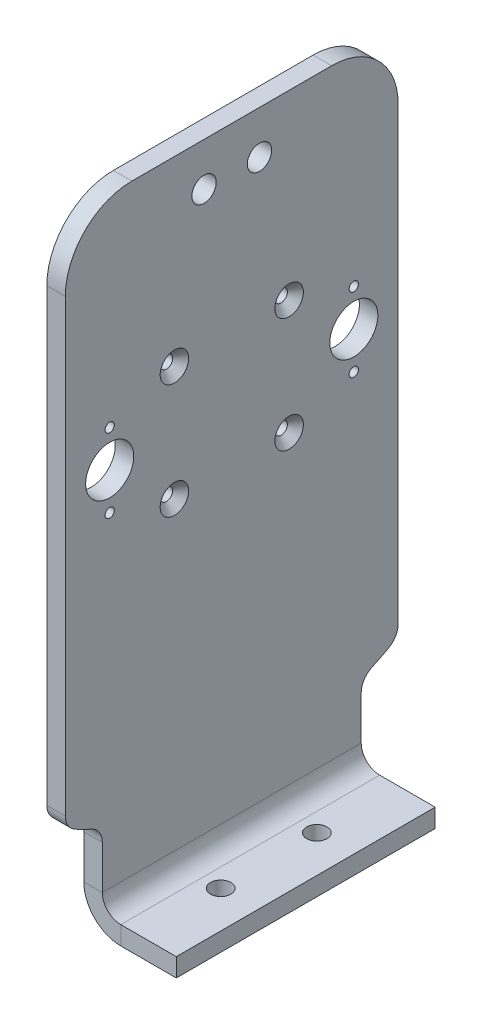
from build123d import *

# Parameters (mm, degrees)
ESBO_O1_W                                           = 20
ESBO_O1_H                                           = 70
FLANGE_BASE1_DEPTH                                  = 5
ARESTA_FLANGE1_STRIP_W                              = 30
ARESTA_FLANGE1_STRIP_H                              = 5
ARESTA_FLANGE1_STRIP_CUT_DEPTH                      = 70
ARESTA_FLANGE1_DEPTH                                = 70
ARESTA_FLANGE1_START                                = 5
ARESTA_FLANGE1_PROFILE_W                            = 90
ARESTA_FLANGE1_PROFILE_H                            = 162.6
ARESTA_FLANGE1_FLAT_DEPTH                           = 5
CORTE_EXTRUS_O1_DEPTH                               = 5
CORTE_EXTRUS_O2_DEPTH                               = 5
FILETE1_R                                           = 5
FILETE2_R                                           = 5
CORTE_EXTRUS_O3_REACH                               = 177.328
ESBO_O14_R                                          = 6.5
FILETE3_R                                           = 18
FILETE4_R                                           = 18
ESBO_O27_R                                          = 3.3
CORTE_EXTRUS_O4_DEPTH                               = 5
ESBO_O28_R                                          = 2.75
CORTE_EXTRUS_O5_DEPTH                               = 5
ESCAREADO_PARA_PARAFUSO_ALLEN_SEXTAVADO_D           = 3.4
ESCAREADO_PARA_PARAFUSO_ALLEN_SEXTAVADO_CSINK_D     = 7.72
ESCAREADO_PARA_PARAFUSO_ALLEN_SEXTAVADO_CSINK_ANGLE = 90
ESBO_O34_R                                          = 1.25
CORTE_EXTRUS_O6_DEPTH                               = 5


# Sheet-metal steps are written as plain solids
with BuildPart() as part:
    # Esboço1 → Flange-base1 (new body)
    with BuildSketch(Plane(origin=(0, 0, 0), x_dir=(1, 0, 0), z_dir=(0, 1, 0))):
        Rectangle(ESBO_O1_W, ESBO_O1_H)
    extrude(amount=-FLANGE_BASE1_DEPTH)

    # Aresta-Flange1 strip (across the edge) → Aresta-Flange1 strip cut (cut)
    with BuildSketch(Plane(origin=(-10, 0, -35), x_dir=(1, 0, 0), z_dir=(0, 0, 1))):
        with Locations((-10, -2.5)):
            Rectangle(ARESTA_FLANGE1_STRIP_W, ARESTA_FLANGE1_STRIP_H)
    extrude(amount=ARESTA_FLANGE1_STRIP_CUT_DEPTH, mode=Mode.SUBTRACT)

    # Aresta-Flange1 bend section (across the edge) → Aresta-Flange1 (add)
    with BuildSketch(Plane(origin=(-10, 0, -35), x_dir=(1, 0, 0), z_dir=(0, 0, 1))):
        with BuildLine():
            Line((-5, 5), (0, 5))
            ThreePointArc((0, 5), (1.464466094, 1.464466094), (5, 0))
            Line((5, 0), (5, -5))
            ThreePointArc((5, -5), (-2.071067812, -2.071067812), (-5, 5))
        make_face()
    extrude(amount=ARESTA_FLANGE1_DEPTH)

    # Aresta-Flange1 profile (on flange) → Aresta-Flange1 flat (add)
    with BuildSketch(Plane.ZY.offset(10).offset(ARESTA_FLANGE1_START)):
        with Locations((0, 86.3)):
            Rectangle(ARESTA_FLANGE1_PROFILE_W, ARESTA_FLANGE1_PROFILE_H)
    extrude(amount=-ARESTA_FLANGE1_FLAT_DEPTH)

    # Esboço11 → Corte-extrusão1 (cut)
    with BuildSketch(Plane(origin=(-10, 0, 0), x_dir=(0, 0, -1), z_dir=(1, 0, 0))):
        with BuildLine():
            Line((35, 5.5), (35, 16.756560302))
            ThreePointArc((35, 16.756560302), (35.785363848, 19.446698236), (37.894736842, 21.291741339))
            ThreePointArc((37.894736842, 21.291741339), (40.139210452, 22.371640143), (42.352941176, 23.513235294))
            ThreePointArc((42.352941176, 23.513235294), (44.287464629, 25.352521223), (45, 27.925))
            Line((45, 27.925), (45, 5))
            Line((45, 5), (35, 5))
            Line((35, 5), (35, 5.5))
        make_face()
    extrude(amount=-CORTE_EXTRUS_O1_DEPTH, mode=Mode.SUBTRACT)

    # Esboço12 → Corte-extrusão2 (cut)
    with BuildSketch(Plane(origin=(-10, 0, 0), x_dir=(0, 0, -1), z_dir=(1, 0, 0))):
        with BuildLine():
            Line((-45, 5), (-35, 5))
            Line((-35, 5), (-35, 20.009380241))
            ThreePointArc((-35, 20.009380241), (-40.077219356, 22.340780151), (-45, 24.982713659))
            Line((-45, 24.982713659), (-45, 5))
        make_face()
    extrude(amount=-CORTE_EXTRUS_O2_DEPTH, mode=Mode.SUBTRACT)

    # Filete1
    filete1_edges = [part.edges().sort_by_distance(p)[0] for p in [
        (-12.5, 20.009380241, 35),
    ]]
    fillet(filete1_edges, radius=FILETE1_R)

    # Filete2
    filete2_edges = [part.edges().sort_by_distance(p)[0] for p in [
        (-12.5, 24.982713659, 45),
    ]]
    fillet(filete2_edges, radius=FILETE2_R)

    # Esboço14 → Corte-extrusão3 (cut, up to next)
    with BuildSketch(Plane.ZY.offset(15), mode=Mode.PRIVATE) as corte_extrus_o3_sk1:
        with Locations(Location((-33, 102.925, 0), (0, 0, 270))):
            Circle(ESBO_O14_R)
    corte_extrus_o3_tool1 = extrude(corte_extrus_o3_sk1.sketch, amount=-CORTE_EXTRUS_O3_REACH, mode=Mode.PRIVATE) & part.part
    # Esboço14 → Corte-extrusão3 (cut, up to next)
    with BuildSketch(Plane.ZY.offset(15), mode=Mode.PRIVATE) as corte_extrus_o3_sk2:
        with Locations(Location((33, 102.925, 0), (0, 0, 270))):
            Circle(ESBO_O14_R)
    corte_extrus_o3_tool2 = extrude(corte_extrus_o3_sk2.sketch, amount=-CORTE_EXTRUS_O3_REACH, mode=Mode.PRIVATE) & part.part
    add(corte_extrus_o3_tool1.solids().sort_by_distance((-15, 102.925, -33))[0], mode=Mode.SUBTRACT)
    add(corte_extrus_o3_tool2.solids().sort_by_distance((-15, 102.925, 33))[0], mode=Mode.SUBTRACT)

    # Filete3
    filete3_edges = [part.edges().sort_by_distance(p)[0] for p in [
        (-12.5, 167.6, 45),
    ]]
    fillet(filete3_edges, radius=FILETE3_R)

    # Filete4
    filete4_edges = [part.edges().sort_by_distance(p)[0] for p in [
        (-12.5, 167.6, -45),
    ]]
    fillet(filete4_edges, radius=FILETE4_R)

    # Esboço27 → Corte-extrusão4 (cut)
    with BuildSketch(Plane.ZY.offset(15)):
        with Locations(Location((7.5, 155.925, 0), (0, 0, 270))):
            Circle(ESBO_O27_R)
        with Locations(Location((-7.5, 155.925, 0), (0, 0, 270))):
            Circle(ESBO_O27_R)
    extrude(amount=-CORTE_EXTRUS_O4_DEPTH, mode=Mode.SUBTRACT)

    # Esboço28 → Corte-extrusão5 (cut)
    with BuildSketch(Plane(origin=(0, 0, 0), x_dir=(1, 0, 0), z_dir=(0, 1, 0))):
        with Locations(Location((0, 13, 0), (0, 0, 270))):
            Circle(ESBO_O28_R)
        with Locations(Location((0, -13, 0), (0, 0, 270))):
            Circle(ESBO_O28_R)
    extrude(amount=-CORTE_EXTRUS_O5_DEPTH, mode=Mode.SUBTRACT)

    # Escareado para parafuso Allen sextavado escareado de M32 (through all)
    with Locations(Plane(origin=(-10, 0, 0), x_dir=(0, 0, -1), z_dir=(1, 0, 0))):
        with Locations((-15.5, 87.425), (-15.5, 118.425), (15.5, 118.425), (15.5, 87.425)):
            CounterSinkHole(ESCAREADO_PARA_PARAFUSO_ALLEN_SEXTAVADO_D / 2, ESCAREADO_PARA_PARAFUSO_ALLEN_SEXTAVADO_CSINK_D / 2, counter_sink_angle=ESCAREADO_PARA_PARAFUSO_ALLEN_SEXTAVADO_CSINK_ANGLE)

    # Esboço34 → Corte-extrusão6 (cut)
    with BuildSketch(Plane(origin=(-10, 0, 0), x_dir=(0, 0, -1), z_dir=(1, 0, 0))):
        with Locations(Location((-33, 112.924999999, 0), (0, 0, 90))):
            Circle(ESBO_O34_R)
        with Locations(Location((-33, 92.924999999, 0), (0, 0, 90))):
            Circle(ESBO_O34_R)
        with Locations(Location((33, 112.924999999, 0), (0, 0, 90))):
            Circle(ESBO_O34_R)
        with Locations(Location((33, 92.924999999, 0), (0, 0, 90))):
            Circle(ESBO_O34_R)
    extrude(amount=-CORTE_EXTRUS_O6_DEPTH, mode=Mode.SUBTRACT)


solid = part.part
